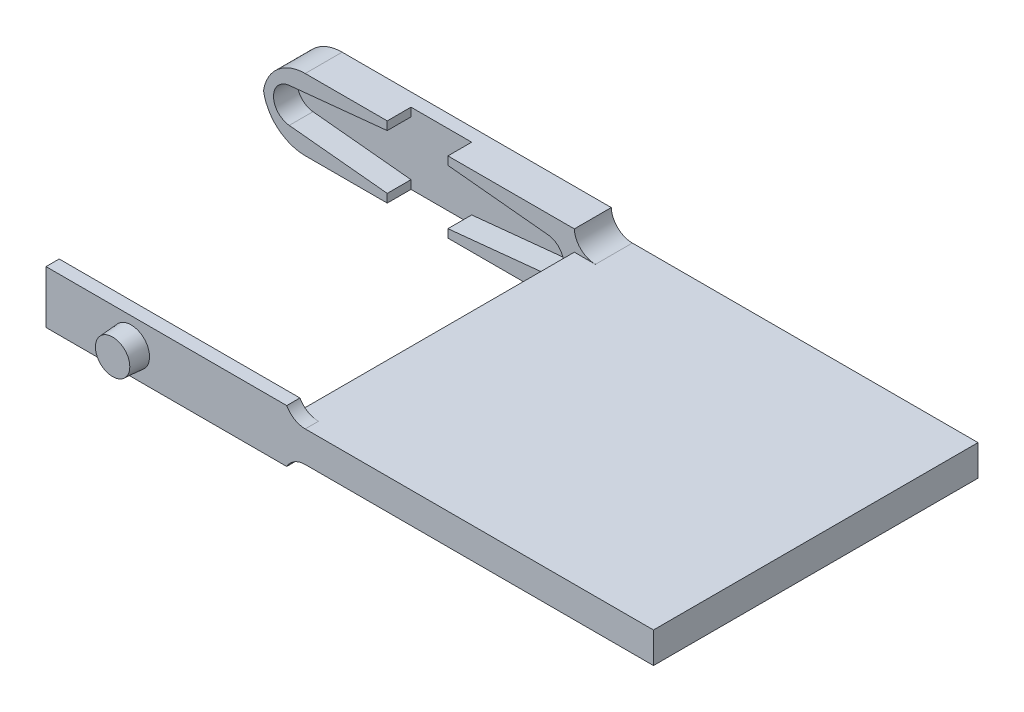
from build123d import *

# Parameters (mm, degrees)
SKETCH1_W            = 29.5
SKETCH1_H            = 6.75
BOSS_EXTRUDE10_DEPTH = 3.5
BOSS_EXTRUDE15_DEPTH = 1.25
SKETCH1_17_W         = 34.75
SKETCH1_17_H         = 2.924143722
BOSS_EXTRUDE17_DEPTH = 30.75
BOSS_EXTRUDE18_DEPTH = 1.25
SKETCH2_9_R          = 1.75
BOSS_EXTRUDE19_DEPTH = 1.75
BOSS_EXTRUDE19_TAPER = 4
FILLET1_R            = 2
FILLET2_R            = 4
CUT_EXTRUDE1_START   = -2.25
SKETCH3_W            = 5.75
SKETCH3_H            = 1.125
CUT_EXTRUDE1_DEPTH   = 2.25


with BuildPart() as part:
    # Sketch1 → Boss-Extrude10 (new body)
    with BuildSketch(Plane.XY):
        with Locations((0, 3.375)):
            Rectangle(SKETCH1_W, SKETCH1_H)
        with BuildLine():
            Line((-12.265078429, 5.016721387), (0, 6.25))
            Line((0, 6.25), (12.265078429, 5.016721387))
            ThreePointArc((12.265078429, 5.016721387), (13.75, 3.375), (12.265078429, 1.733278613))
            Line((12.265078429, 1.733278613), (0, 0.5))
            Line((0, 0.5), (-12.265078429, 1.733278613))
            ThreePointArc((-12.265078429, 1.733278613), (-13.75, 3.375), (-12.265078429, 5.016721387))
        make_face(mode=Mode.SUBTRACT)
    extrude(amount=BOSS_EXTRUDE10_DEPTH)

    # Sketch1<16> → Boss-Extrude15 (add)
    with BuildSketch(Plane.XY):
        with BuildLine():
            ThreePointArc((-12.265078429, 5.016721387), (-13.75, 3.375), (-12.265078429, 1.733278613))
            Line((-12.265078429, 1.733278613), (0, 0.5))
            Line((0, 0.5), (12.265078429, 1.733278613))
            ThreePointArc((12.265078429, 1.733278613), (13.75, 3.375), (12.265078429, 5.016721387))
            Line((12.265078429, 5.016721387), (0, 6.25))
            Line((0, 6.25), (-12.265078429, 5.016721387))
        make_face()
    extrude(amount=BOSS_EXTRUDE15_DEPTH)

    # Sketch1<17> → Boss-Extrude17 (add)
    with BuildSketch(Plane.XY):
        with Locations((32.125, 3.375)):
            Rectangle(SKETCH1_17_W, SKETCH1_17_H)
    extrude(amount=BOSS_EXTRUDE17_DEPTH)

    # Sketch2 → Boss-Extrude18 (add)
    with BuildSketch(Plane.XY.offset(30.75)):
        Polygon((13.5, 5.875), (-8.061356684, 5.875), (-8.061356684, 0.875), (14.75, 0.875), (14.75, 5.875), align=None)
    extrude(amount=-BOSS_EXTRUDE18_DEPTH)

    # Sketch2<9> → Boss-Extrude19 (add)
    with BuildSketch(Plane.XY.offset(30.75)):
        with Locations((0, 3.375)):
            Circle(SKETCH2_9_R)
    extrude(amount=BOSS_EXTRUDE19_DEPTH, taper=BOSS_EXTRUDE19_TAPER)

    # Fillet1
    # the kernel refuses this fillet: 2 mm, written as the material it adds along each edge
    with BuildSketch(Plane(origin=(14.75, 1.912928139, 0), x_dir=(0, -1, 0), z_dir=(0, 0, 1))) as fillet1_piece_1:
        with BuildLine():
            CenterArc((2, 1.998103724), FILLET1_R, 180, 87.504786267)
            Line((0, 1.998103724), (0, 0))
            Line((0, 0), (1.912928139, 0))
        make_face()
    extrude(amount=3.5)
    with BuildSketch(Plane(origin=(14.75, 4.837071861, 0), x_dir=(1, 0, 0), z_dir=(0, 0, 1))) as fillet1_piece_2:
        with BuildLine():
            CenterArc((1.998103724, 2), FILLET1_R, 182.495213733, 87.504786267)
            Line((0, 1.912928139), (0, 0))
            Line((0, 0), (1.998103724, 0))
        make_face()
    extrude(amount=3.5)
    with BuildSketch(Plane(origin=(14.75, 1.912928139, 29.5), x_dir=(1, 0, 0), z_dir=(0, 0, 1))) as fillet1_piece_3:
        with BuildLine():
            CenterArc((1.753401761, -2), FILLET1_R, 90, 61.246917848)
            Line((0, -1.037928139), (0, 0))
            Line((0, 0), (1.753401761, 0))
        make_face()
    extrude(amount=1.25)
    with BuildSketch(Plane(origin=(14.75, 4.837071861, 29.5), x_dir=(1, 0, 0), z_dir=(0, 0, 1))) as fillet1_piece_4:
        with BuildLine():
            CenterArc((1.753401761, 2), FILLET1_R, 208.753082152, 61.246917848)
            Line((0, 1.037928139), (0, 0))
            Line((0, 0), (1.753401761, 0))
        make_face()
    extrude(amount=1.25)

    # Fillet2
    # the kernel refuses this fillet: 4 mm, written as the material it takes off along each edge
    with BuildSketch(Plane(origin=(-14.75, 6.75, -10), x_dir=(0, -1, 0), z_dir=(0, 0, 1)), Plane(origin=(-14.75, 0, -10), x_dir=(1, 0, 0), z_dir=(0, 0, 1))) as fillet2_piece_1:
        with BuildLine():
            CenterArc((FILLET2_R, FILLET2_R), FILLET2_R, 180, 90)
            Line((0, FILLET2_R), (0, 0))
            Line((0, 0), (FILLET2_R, 0))
        make_face()
    extrude(amount=23.5, mode=Mode.SUBTRACT)

    # Sketch3 → Cut-Extrude1 (cut)
    with BuildSketch(Plane.XY.offset(3.5).offset(CUT_EXTRUDE1_START)):
        with Locations((-0.102107464, 6.1875)):
            Rectangle(SKETCH3_W, SKETCH3_H)
        with Locations((-0.102107464, 0.5625)):
            Rectangle(SKETCH3_W, SKETCH3_H)
    extrude(amount=CUT_EXTRUDE1_DEPTH, mode=Mode.SUBTRACT)


solid = part.part
